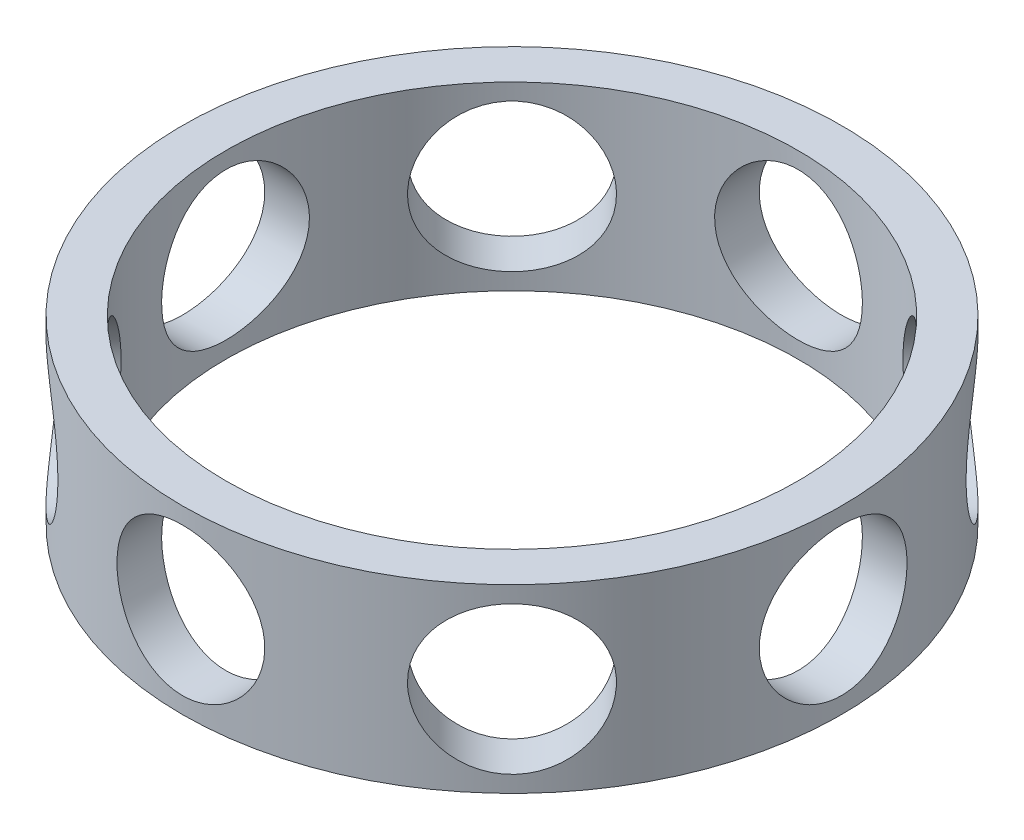
from build123d import *

# Parameters (mm, degrees)
BOSS_EXTRUDE1_DEPTH      = 0.93218
BOSS_EXTRUDE1_DEPTH_BACK = 0.93218
SKETCH1_R                = 3.39852
SKETCH1_R_2              = 2.95148
CUT_EXTRUDE1_REACH       = 6.896
CUT_EXTRUDE1_END_RADIUS  = 3.39852
SKETCH3_R                = 0.762
CIRPATTERN1_COUNT        = 8


with BuildPart() as part:
    # Sketch1 → Boss-Extrude1 (new, two sides: drawn at the far end of the back side and taken through both)
    with BuildSketch(Plane(origin=(0, 0, 0), x_dir=(1, 0, 0), z_dir=(0, 1, 0)).offset(-BOSS_EXTRUDE1_DEPTH_BACK)):
        Circle(SKETCH1_R)
        Circle(SKETCH1_R_2, mode=Mode.SUBTRACT)
    extrude(amount=BOSS_EXTRUDE1_DEPTH + BOSS_EXTRUDE1_DEPTH_BACK)

    # Cut-Extrude1: up to this cylinder (the profile starts inside it)
    cut_extrude1_end = Plane(origin=(0, 0, 0), z_dir=(0, 1, 0)) * Cylinder(CUT_EXTRUDE1_END_RADIUS, 21.58904, mode=Mode.PRIVATE)
    # Sketch3 → Cut-Extrude1 (cut, up to the surface)
    with BuildSketch(Plane.XY, mode=Mode.PRIVATE) as cut_extrude1_sk1:
        Circle(SKETCH3_R)
    cut_extrude1_tool1 = extrude(cut_extrude1_sk1.sketch, amount=-CUT_EXTRUDE1_REACH, mode=Mode.PRIVATE) & cut_extrude1_end
    cut_extrude1 = cut_extrude1_tool1.solids().sort_by_distance((0, 0, 0))[0]
    add(cut_extrude1, mode=Mode.SUBTRACT)

    # CirPattern1: Cut-Extrude1 ×8 about axis
    cirpattern1_axis = Axis((0, 0, 0), (0, 1, 0))
    for i in range(1, CIRPATTERN1_COUNT):
        add(cut_extrude1.rotate(cirpattern1_axis, i * 360 / CIRPATTERN1_COUNT), mode=Mode.SUBTRACT)


solid = part.part
